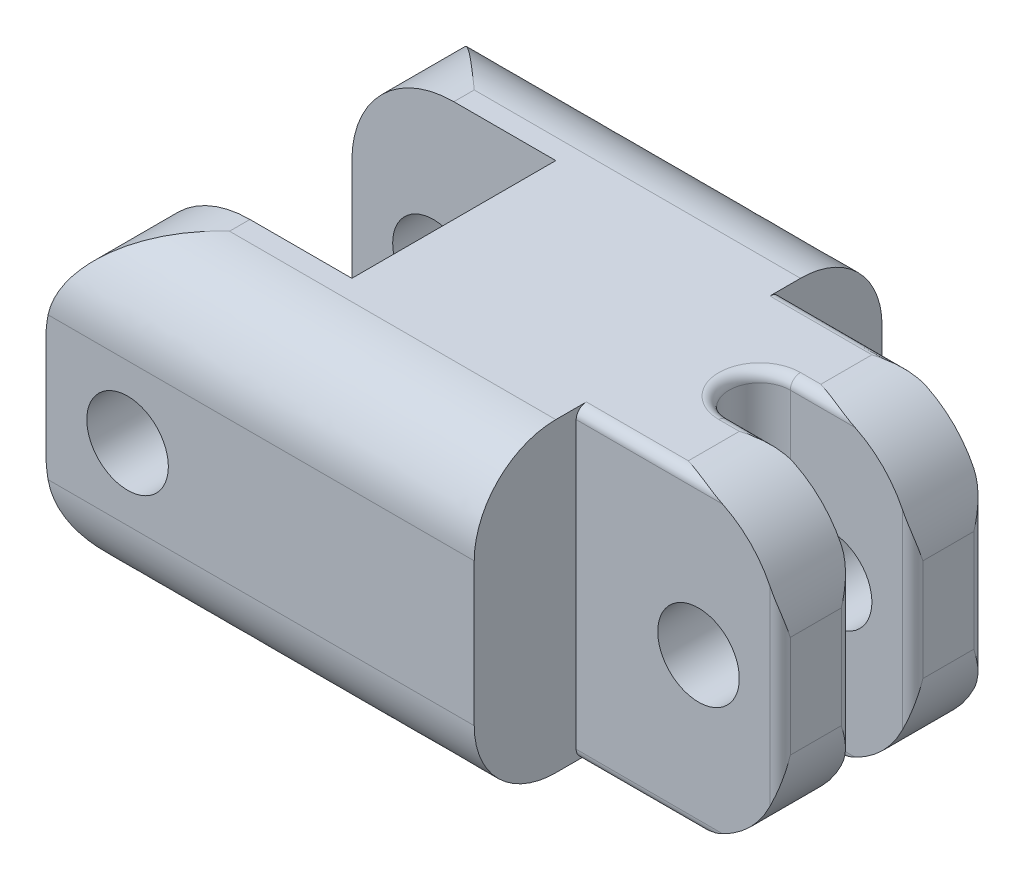
from build123d import *

# Parameters (mm, degrees)
BOSS_EXTRUDE1_DEPTH      = 18
BOSS_EXTRUDE1_DEPTH_BACK = 13
SKETCH1_W                = 20
SKETCH1_H                = 15
SKETCH2_W                = 10
SKETCH2_H                = 10
CUT_EXTRUDE1_DEPTH       = 19
VARFILLET1_R             = 4
VARFILLET2_R             = 4
CUT_EXTRUDE3_DEPTH       = 11
CUT_EXTRUDE3_DEPTH_BACK  = 11
SKETCH4_R                = 2
SKETCH5_W                = 10
SKETCH5_H                = 5
CUT_EXTRUDE4_DEPTH       = 19
FILLET1_R                = 0.5
CUT_EXTRUDE5_DEPTH       = 19
CUT_EXTRUDE5_DEPTH_BACK  = 19
SKETCH6_R                = 2
CUT_EXTRUDE6_DEPTH       = 19
CUT_EXTRUDE6_DEPTH_BACK  = 19


with BuildPart() as part:
    # Sketch1 → Boss-Extrude1 (new, two sides: drawn at the far end of the back side and taken through both)
    with BuildSketch(Plane(origin=(0, 0, 0), x_dir=(0, 0, -1), z_dir=(1, 0, 0)).offset(-BOSS_EXTRUDE1_DEPTH_BACK)):
        Rectangle(SKETCH1_W, SKETCH1_H)
    extrude(amount=BOSS_EXTRUDE1_DEPTH + BOSS_EXTRUDE1_DEPTH_BACK)

    # Sketch2 → Cut-Extrude1 (cut)
    with BuildSketch(Plane(origin=(0, 7.5, 0), x_dir=(1, 0, 0), z_dir=(0, 1, 0))):
        with Locations((-8, 0)):
            Rectangle(SKETCH2_W, SKETCH2_H)
    extrude(amount=-CUT_EXTRUDE1_DEPTH, mode=Mode.SUBTRACT)

    # VarFillet1
    varfillet1_edges = [part.edges().sort_by_distance(p)[0] for p in [
        (2.5, 7.5, -10),
        (2.5, 7.5, 10),
    ]]
    fillet(varfillet1_edges, radius=VARFILLET1_R)

    # VarFillet2
    varfillet2_edges = [part.edges().sort_by_distance(p)[0] for p in [
        (2.5, -7.5, 10),
        (2.5, -7.5, -10),
    ]]
    fillet(varfillet2_edges, radius=VARFILLET2_R)

    # Sketch4 → Cut-Extrude3 (cut, two sides: drawn at the far end of the back side and taken through both)
    with BuildSketch(Plane.XY.offset(-CUT_EXTRUDE3_DEPTH_BACK)):
        with Locations((-9, 0)):
            Circle(SKETCH4_R)
    extrude(amount=CUT_EXTRUDE3_DEPTH + CUT_EXTRUDE3_DEPTH_BACK, mode=Mode.SUBTRACT)

    # Sketch5 → Cut-Extrude4 (cut)
    with BuildSketch(Plane(origin=(0, 7.5, 0), x_dir=(1, 0, 0), z_dir=(0, 1, 0))):
        with Locations((13, 7.5)):
            Rectangle(SKETCH5_W, SKETCH5_H)
        with BuildLine():
            Line((18, 1.5), (12, 1.5))
            ThreePointArc((12, 1.5), (10.5, 0), (12, -1.5))
            Line((12, -1.5), (18, -1.5))
            Line((18, -1.5), (18, 1.5))
        make_face()
        with Locations((13, -7.5)):
            Rectangle(SKETCH5_W, SKETCH5_H)
    extrude(amount=-CUT_EXTRUDE4_DEPTH, mode=Mode.SUBTRACT)

    # Fillet1
    fillet1_edges = [part.edges().sort_by_distance(p)[0] for p in [
        (15, 7.5, -1.5),
        (15, 7.5, 1.5),
        (15, -7.5, 1.5),
        (15, -7.5, -1.5),
        (18, 0, 5),
        (18, 7.5, 3.25),
        (18, 0, 1.5),
        (18, -7.5, 3.25),
        (10.5, 7.5, 0),
        (10.5, -7.5, 0),
        (18, 0, -1.5),
        (18, 7.5, -3.25),
        (18, 0, -5),
        (18, -7.5, -3.25),
        (13, -7.5, -5),
        (13, -7.5, 5),
        (13, 7.5, -5),
        (13, 7.5, 5),
    ]]
    fillet(fillet1_edges, radius=FILLET1_R)

    # Sketch6 → Cut-Extrude5 (cut, two sides: drawn at the far end of the back side and taken through both)
    with BuildSketch(Plane.XY.offset(-CUT_EXTRUDE5_DEPTH_BACK)):
        with Locations((14, 0)):
            Circle(SKETCH6_R)
    extrude(amount=CUT_EXTRUDE5_DEPTH + CUT_EXTRUDE5_DEPTH_BACK, mode=Mode.SUBTRACT)

    # Sketch7 → Cut-Extrude6 (cut, two sides: drawn at the far end of the back side and taken through both)
    with BuildSketch(Plane.XY.offset(-CUT_EXTRUDE6_DEPTH_BACK)):
        with BuildLine():
            Line((-8, 7.5), (-13, 7.5))
            Line((-13, 7.5), (-13, 2.5))
            ThreePointArc((-13, 2.5), (-11.535533906, 6.035533906), (-8, 7.5))
        make_face()
        with BuildLine():
            Line((-13, -7.5), (-13, -2.5))
            ThreePointArc((-13, -2.5), (-11.535533906, -6.035533906), (-8, -7.5))
            Line((-8, -7.5), (-13, -7.5))
        make_face()
        with BuildLine():
            Line((13, 7.5), (18, 7.5))
            Line((18, 7.5), (18, 2.5))
            ThreePointArc((18, 2.5), (16.535533906, 6.035533906), (13, 7.5))
        make_face()
        with BuildLine():
            Line((18, -7.5), (18, -2.5))
            ThreePointArc((18, -2.5), (16.535533906, -6.035533906), (13, -7.5))
            Line((13, -7.5), (18, -7.5))
        make_face()
    extrude(amount=CUT_EXTRUDE6_DEPTH + CUT_EXTRUDE6_DEPTH_BACK, mode=Mode.SUBTRACT)


solid = part.part
